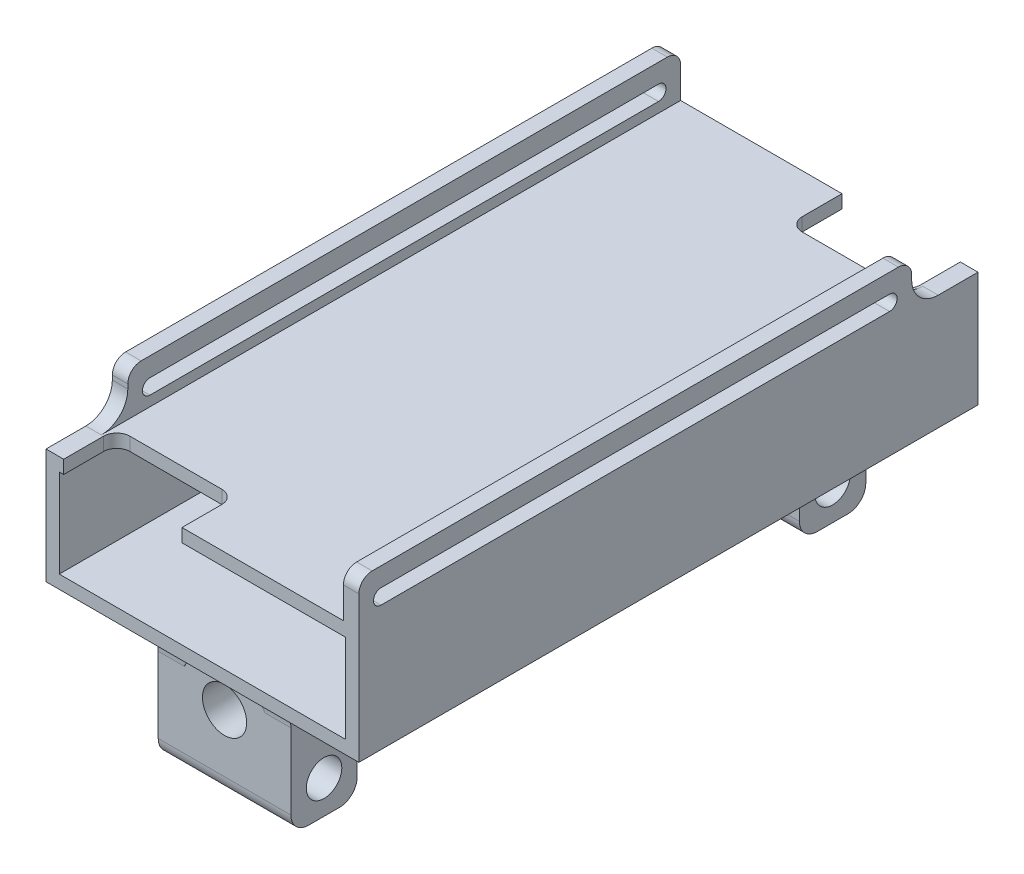
from build123d import *

# Parameters (mm, degrees)
SKETCH1_W            = 64.75
SKETCH1_H            = 20
BODY_DEPTH           = 140
SHELL1_T             = 3
SWITCH_CUTOUT_REACH  = 148.722
SKETCH2_W            = 26.75
SKETCH2_H            = 12
SKETCH4_W            = 15
SKETCH4_H            = 27
SKETCH4_R            = 4.0125
AXLE_HOLDER_DEPTH    = 15
SKETCH5_R            = 4.0125
SKETCH5_R_2          = 2.5
BUSHING_HOLDER_DEPTH = 9
FILLET3_R            = 4
FILLET4_R            = 6
SKETCH6_W            = 125
SKETCH6_H            = 10
SLIDE_MOUNT_DEPTH    = 3.5
CIRPATTERN1_COUNT    = 2
FILLET6_R            = 3
FILLET7_R            = 3
FILLET8_R            = 6
CUT_EXTRUDE1_REACH   = 147.177
SKETCH7_R            = 5
SKETCH8_R            = 9.916079783
CUT_EXTRUDE2_DEPTH   = 9
CUT_EXTRUDE3_DEPTH   = 3.5


with BuildPart() as part:
    # Sketch1 → Body (new body)
    with BuildSketch(Plane.XY):
        Rectangle(SKETCH1_W, SKETCH1_H)
    extrude(amount=BODY_DEPTH)

    # Shell1
    shell1_openings = [part.faces().sort_by_distance(p)[0] for p in [
        (0, 0, 0),
        (0, 0, 140),
    ]]
    offset(amount=SHELL1_T, openings=shell1_openings, kind=Kind.INTERSECTION)

    # Sketch2 → Switch_cutout (cut, up to next)
    with BuildSketch(Plane(origin=(0, 13, 0), x_dir=(1, 0, 0), z_dir=(0, 1, 0)), mode=Mode.PRIVATE) as switch_cutout_sk1:
        with Locations((18, -6)):
            Rectangle(SKETCH2_W, SKETCH2_H)
    switch_cutout_tool1 = extrude(switch_cutout_sk1.sketch, amount=-SWITCH_CUTOUT_REACH, mode=Mode.PRIVATE) & part.part
    # Sketch2 → Switch_cutout (cut, up to next)
    with BuildSketch(Plane(origin=(0, 13, 0), x_dir=(1, 0, 0), z_dir=(0, 1, 0)), mode=Mode.PRIVATE) as switch_cutout_sk2:
        with Locations((-18, -134)):
            Rectangle(SKETCH2_W, SKETCH2_H)
    switch_cutout_tool2 = extrude(switch_cutout_sk2.sketch, amount=-SWITCH_CUTOUT_REACH, mode=Mode.PRIVATE) & part.part
    add(switch_cutout_tool1.solids().sort_by_distance((18, 13, 6))[0], mode=Mode.SUBTRACT)
    add(switch_cutout_tool2.solids().sort_by_distance((-18, 13, 134))[0], mode=Mode.SUBTRACT)

    # Sketch4 → Axle_holder (add, symmetric)
    # profile 1 of 2: a face of its own
    with BuildSketch(Plane.ZY):
        with Locations((12.5, -26.5)):
            Rectangle(SKETCH4_W, SKETCH4_H)
        with Locations(Location((12.5, -32.5, 0), (0, 0, 270))):
            Circle(SKETCH4_R, mode=Mode.SUBTRACT)
    # profile 2 of 2: a face of its own
    with BuildSketch(Plane.ZY):
        with Locations((127.5, -26.5)):
            Rectangle(SKETCH4_W, SKETCH4_H)
        with Locations(Location((127.5, -32.5, 0), (0, 0, 90))):
            Circle(SKETCH4_R, mode=Mode.SUBTRACT)
    extrude(amount=AXLE_HOLDER_DEPTH, both=True)

    # Sketch5 → Bushing_holder (add, symmetric)
    # profile 1 of 2: a face of its own
    with BuildSketch(Plane.ZY):
        with Locations(Location((12.5, -32.5, 0), (0, 0, 270))):
            Circle(SKETCH5_R)
        with Locations(Location((12.5, -32.5, 0), (0, 0, 270))):
            Circle(SKETCH5_R_2, mode=Mode.SUBTRACT)
    # profile 2 of 2: a face of its own
    with BuildSketch(Plane.ZY):
        with Locations(Location((127.5, -32.5, 0), (0, 0, 90))):
            Circle(SKETCH5_R)
        with Locations(Location((127.5, -32.5, 0), (0, 0, 270))):
            Circle(SKETCH5_R_2, mode=Mode.SUBTRACT)
    extrude(amount=BUSHING_HOLDER_DEPTH, both=True)

    # Fillet3
    fillet3_edges = [part.edges().sort_by_distance(p)[0] for p in [
        (0, -40, 5),
        (0, -40, 20),
        (0, -40, 135),
        (0, -40, 120),
    ]]
    fillet(fillet3_edges, radius=FILLET3_R)

    # Fillet4
    # the kernel refuses this fillet: 6 mm, written as the material it adds along each edge
    with BuildSketch(Plane(origin=(15, -13, 5), x_dir=(0, 0, -1), z_dir=(-1, 0, 0))) as fillet4_piece_1:
        with BuildLine():
            CenterArc((6, 5.916079783), FILLET4_R, 180, 80.405931773)
            Line((0, 5.916079783), (-0.12, 5.916079783))
            Line((-0.12, 5.916079783), (-0.12, 0))
            Line((-0.12, 0), (0, -0.12))
            ThreePointArc((0, -0.12), (2.5, -0.12), (4.98, -0.118321596))
            Line((4.98, -0.118321596), (5, 0))
        make_face()
    extrude(amount=30)
    with BuildSketch(Plane(origin=(-15, -13, 20), x_dir=(0, 0, 1), z_dir=(1, 0, 0)), Plane(origin=(-15, -13, 120), x_dir=(0, -1, 0), z_dir=(1, 0, 0))) as fillet4_piece_2:
        with BuildLine():
            CenterArc((FILLET4_R, FILLET4_R), FILLET4_R, 180, 90)
            Line((0, FILLET4_R), (-FILLET4_R * 0.02, FILLET4_R))
            Line((-FILLET4_R * 0.02, FILLET4_R), (-FILLET4_R * 0.02, -FILLET4_R * 0.02))
            Line((-FILLET4_R * 0.02, -FILLET4_R * 0.02), (FILLET4_R, -FILLET4_R * 0.02))
            Line((FILLET4_R, -FILLET4_R * 0.02), (FILLET4_R, 0))
        make_face()
    extrude(amount=30)
    with BuildSketch(Plane(origin=(15, -13, 135), x_dir=(0, 0, 1), z_dir=(-1, 0, 0))) as fillet4_piece_3:
        with BuildLine():
            CenterArc((6, -5.916079783), FILLET4_R, 99.594068227, 80.405931773)
            Line((0, -5.916079783), (-0.12, -5.916079783))
            Line((-0.12, -5.916079783), (-0.12, 0))
            Line((-0.12, 0), (0, 0.12))
            ThreePointArc((0, 0.12), (2.5, 0.12), (4.98, 0.118321596))
            Line((4.98, 0.118321596), (5, 0))
        make_face()
    extrude(amount=30)

    # Sketch6 → Slide_mount (add)
    with BuildSketch(Plane(origin=(35.375, 0, 0), x_dir=(0, 0, -1), z_dir=(1, 0, 0))):
        with Locations((-77.5, 18)):
            Rectangle(SKETCH6_W, SKETCH6_H)
        with BuildLine():
            Line((-135, 18.7), (-20, 18.7))
            ThreePointArc((-20, 18.7), (-18.3, 17), (-20, 15.3))
            Line((-20, 15.3), (-135, 15.3))
            ThreePointArc((-135, 15.3), (-136.7, 17), (-135, 18.7))
        make_face(mode=Mode.SUBTRACT)
    slide_mount = extrude(amount=-SLIDE_MOUNT_DEPTH)

    # CirPattern1: Slide_mount ×2 about axis
    cirpattern1_axis = Axis((0, 0, 70), (0, 1, 0))
    for i in range(1, CIRPATTERN1_COUNT):
        add(slide_mount.rotate(cirpattern1_axis, i * 360 / CIRPATTERN1_COUNT))

    # Fillet6
    fillet6_edges = [part.edges().sort_by_distance(p)[0] for p in [
        (33.625, 23, 140),
        (33.625, 23, 15),
        (-33.625, 23, 0),
        (-33.625, 23, 125),
    ]]
    fillet(fillet6_edges, radius=FILLET6_R)

    # Fillet7
    fillet7_edges = [part.edges().sort_by_distance(p)[0] for p in [
        (4.625, 11.5, 12),
        (31.375, 11.5, 12),
        (-31.375, 11.5, 128),
        (-4.625, 11.5, 128),
    ]]
    fillet(fillet7_edges, radius=FILLET7_R)

    # Fillet8
    fillet8_edges = [part.edges().sort_by_distance(p)[0] for p in [
        (33.625, 13, 15),
        (-33.625, 13, 125),
    ]]
    fillet(fillet8_edges, radius=FILLET8_R)

    # Sketch7 → Cut-Extrude1 (cut, up to next)
    with BuildSketch(Plane.XY.offset(135), mode=Mode.PRIVATE) as cut_extrude1_sk1:
        with Locations(Location((0, -22.916079783, 0), (0, 0, 51.555975818))):
            Circle(SKETCH7_R)
    cut_extrude1_tool1 = extrude(cut_extrude1_sk1.sketch, amount=-CUT_EXTRUDE1_REACH, mode=Mode.PRIVATE) & part.part
    add(cut_extrude1_tool1.solids().sort_by_distance((0, -22.91608, 135))[0], mode=Mode.SUBTRACT)

    # Sketch8 → Cut-Extrude2 (cut)
    with BuildSketch(Plane.XY.offset(135)):
        with Locations((0, -22.916079783)):
            Circle(SKETCH8_R)
    extrude(amount=CUT_EXTRUDE2_DEPTH, mode=Mode.SUBTRACT)

    # Sketch9 → Cut-Extrude3 (cut, symmetric)
    with BuildSketch(Plane(origin=(0, 0, 120), x_dir=(-1, 0, 0), z_dir=(0, 0, -1))):
        Polygon((-6.697263123, -22.916079783), (-3.348631561, -28.716079783), (3.348631561, -28.716079783), (6.697263123, -22.916079783), (3.348631561, -17.116079783), (-3.348631561, -17.116079783), align=None)
    extrude(amount=CUT_EXTRUDE3_DEPTH, both=True, mode=Mode.SUBTRACT)


solid = part.part
